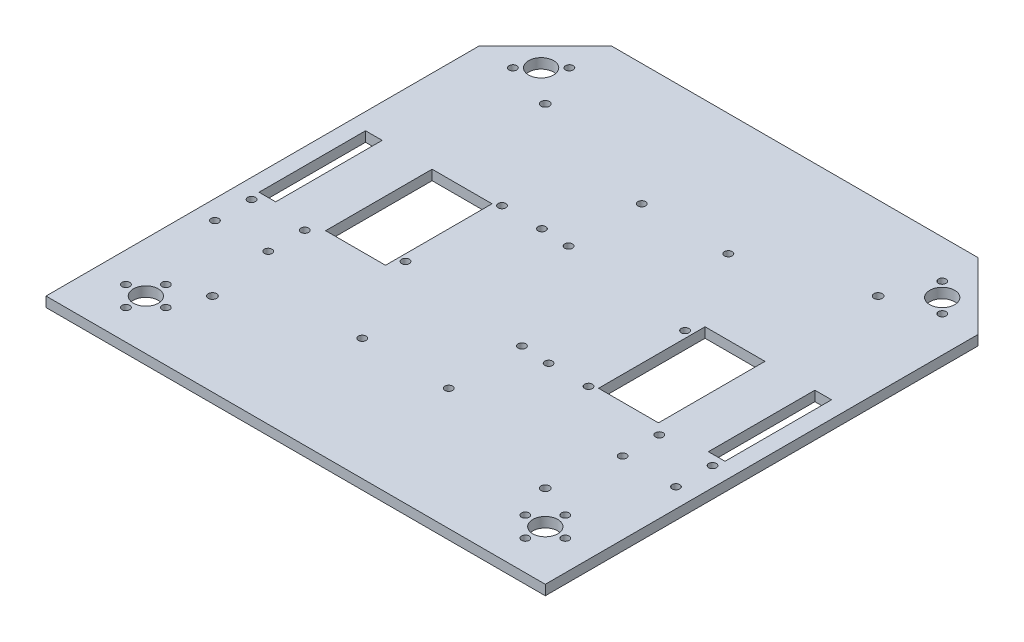
from build123d import *

# Parameters (mm, degrees)
ESQUISSE1_R              = 7.5
ESQUISSE1_R_2            = 2.3
BOSS_EXTRU_1_DEPTH       = 6
ENL_V_MAT_EXTRU_9_DEPTH  = 10.5
ESQUISSE6_R              = 2.3
ENL_V_MAT_EXTRU_10_DEPTH = 50
ENL_V_MAT_EXTRU_11_DEPTH = 50
ESQUISSE9_R              = 2.5
ENL_V_MAT_EXTRU_12_DEPTH = 35
ESQUISSE11_R             = 2.3
ENL_V_MAT_EXTRU_15_DEPTH = 10


with BuildPart() as part:
    # Esquisse1 → Boss.-Extru.1 (new body)
    with BuildSketch(Plane(origin=(0, 0, 0), x_dir=(1, 0, 0), z_dir=(0, 1, 0))):
        Polygon((-150, 0), (-150, 260), (-110, 300), (110, 300), (150, 260), (150, 0), align=None)
        with Locations((-120, 30)):
            Circle(ESQUISSE1_R, mode=Mode.SUBTRACT)
        with Locations((-120, 267.5)):
            Circle(ESQUISSE1_R, mode=Mode.SUBTRACT)
        with Locations((120, 268.5)):
            Circle(ESQUISSE1_R, mode=Mode.SUBTRACT)
        with Locations((-111.514718626, 275.985281374)):
            Circle(ESQUISSE1_R_2, mode=Mode.SUBTRACT)
        with Locations((-128.485281374, 259.014718626)):
            Circle(ESQUISSE1_R_2, mode=Mode.SUBTRACT)
        with Locations((111.514718626, 276.985281374)):
            Circle(ESQUISSE1_R_2, mode=Mode.SUBTRACT)
        with Locations((128.485281374, 260.014718626)):
            Circle(ESQUISSE1_R_2, mode=Mode.SUBTRACT)
        with Locations((120, 30)):
            Circle(ESQUISSE1_R, mode=Mode.SUBTRACT)
        with Locations((120, 42)):
            Circle(ESQUISSE1_R_2, mode=Mode.SUBTRACT)
        with Locations((-120, 42)):
            Circle(ESQUISSE1_R_2, mode=Mode.SUBTRACT)
        with Locations((-120, 18)):
            Circle(ESQUISSE1_R_2, mode=Mode.SUBTRACT)
        with Locations((-132, 30)):
            Circle(ESQUISSE1_R_2, mode=Mode.SUBTRACT)
        with Locations((-108, 30)):
            Circle(ESQUISSE1_R_2, mode=Mode.SUBTRACT)
        with Locations((108, 30)):
            Circle(ESQUISSE1_R_2, mode=Mode.SUBTRACT)
        with Locations((132, 30)):
            Circle(ESQUISSE1_R_2, mode=Mode.SUBTRACT)
        with Locations((120, 18)):
            Circle(ESQUISSE1_R_2, mode=Mode.SUBTRACT)
    extrude(amount=BOSS_EXTRU_1_DEPTH)

    # Esquisse7 → Enlèv. mat.-Extru.9 (cut)
    with BuildSketch(Plane(origin=(0, 6, 0), x_dir=(1, 0, 0), z_dir=(0, 1, 0))):
        Polygon((-130, 150), (-130, 182), (-140, 182), (-140, 118), (-130, 118), align=None)
    enl_v_mat_extru_9 = extrude(amount=-ENL_V_MAT_EXTRU_9_DEPTH, mode=Mode.SUBTRACT)

    # Esquisse6 → Enlèv. mat.-Extru.10 (cut)
    with BuildSketch(Plane(origin=(0, 6, 0), x_dir=(1, 0, 0), z_dir=(0, 1, 0))):
        with Locations((-138.5, 90)):
            Circle(ESQUISSE6_R)
        with Locations((-138.5, 112)):
            Circle(ESQUISSE6_R)
        with Locations((-106.5, 112)):
            Circle(ESQUISSE6_R)
        with Locations((-106.5, 90)):
            Circle(ESQUISSE6_R)
    enl_v_mat_extru_10 = extrude(amount=-ENL_V_MAT_EXTRU_10_DEPTH, mode=Mode.SUBTRACT)

    # Esquisse4 → Enlèv. mat.-Extru.11 (cut)
    with BuildSketch(Plane(origin=(0, 6, 0), x_dir=(1, 0, 0), z_dir=(0, 1, 0))):
        Polygon((-100, 150), (-100, 182), (-64, 182), (-64, 118), (-100, 118), align=None)
    enl_v_mat_extru_11 = extrude(amount=-ENL_V_MAT_EXTRU_11_DEPTH, mode=Mode.SUBTRACT)

    # Symétrie1: Enlèv. mat.-Extru.9 across plane
    add(enl_v_mat_extru_9.mirror(Plane(origin=(0, 0, 0), x_dir=(0, 0, 1), z_dir=(1, 0, 0))), mode=Mode.SUBTRACT)

    # Symétrie2: Enlèv. mat.-Extru.11 across plane
    add(enl_v_mat_extru_11.mirror(Plane(origin=(0, 0, 0), x_dir=(0, 0, 1), z_dir=(1, 0, 0))), mode=Mode.SUBTRACT)

    # Symétrie3: Enlèv. mat.-Extru.10 across plane
    add(enl_v_mat_extru_10.mirror(Plane(origin=(0, 0, 0), x_dir=(0, 0, 1), z_dir=(1, 0, 0))), mode=Mode.SUBTRACT)

    # Esquisse9 → Enlèv. mat.-Extru.12 (cut)
    with BuildSketch(Plane(origin=(0, 6, 0), x_dir=(1, 0, 0), z_dir=(0, 1, 0))):
        with Locations((-100, 50)):
            Circle(ESQUISSE9_R)
        with Locations((100, 50)):
            Circle(ESQUISSE9_R)
        with Locations((100, 250)):
            Circle(ESQUISSE9_R)
        with Locations((-100, 250)):
            Circle(ESQUISSE9_R)
    extrude(amount=-ENL_V_MAT_EXTRU_12_DEPTH, mode=Mode.SUBTRACT)

    # Esquisse11 → Enlèv. mat.-Extru.15 (cut)
    with BuildSketch(Plane(origin=(0, 6, 0), x_dir=(1, 0, 0), z_dir=(0, 1, 0))):
        with Locations((36, 116)):
            Circle(ESQUISSE11_R)
        with Locations((60, 116)):
            Circle(ESQUISSE11_R)
        with Locations((60, 174)):
            Circle(ESQUISSE11_R)
        with Locations((-19, 227)):
            Circle(ESQUISSE11_R)
        with Locations((-19, 183)):
            Circle(ESQUISSE11_R)
        with Locations((33, 227)):
            Circle(ESQUISSE11_R)
        with Locations((19, 117)):
            Circle(ESQUISSE11_R)
        with Locations((19, 73)):
            Circle(ESQUISSE11_R)
        with Locations((-33, 73)):
            Circle(ESQUISSE11_R)
        with Locations((-60, 126)):
            Circle(ESQUISSE11_R)
        with Locations((-36, 184)):
            Circle(ESQUISSE11_R)
        with Locations((-60, 184)):
            Circle(ESQUISSE11_R)
    extrude(amount=-ENL_V_MAT_EXTRU_15_DEPTH, mode=Mode.SUBTRACT)


solid = part.part
